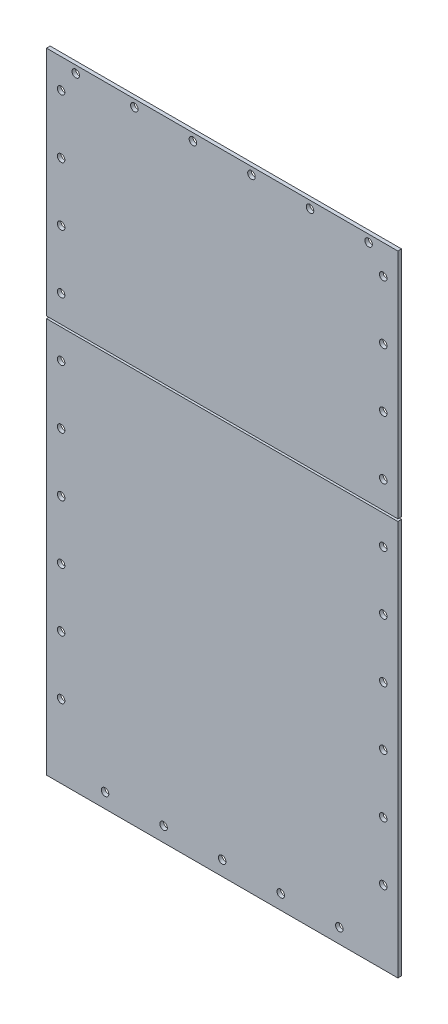
from build123d import *

# Parameters (mm, degrees)
SKETCH1_W             = 152.4
SKETCH1_H             = 100.6
SKETCH1_R             = 1.63195
BOSS_EXTRUDE1_DEPTH   = 1.5875
SKETCH1_H_2           = 171.45
BOSS_EXTRUDE1_2_DEPTH = 1.5875


with BuildPart() as part:
    # Sketch1 → Boss-Extrude1 (new body)
    with BuildSketch(Plane.XY):
        with Locations((76.2, -50.3)):
            Rectangle(SKETCH1_W, SKETCH1_H)
        with Locations((6.35, -88.9)):
            Circle(SKETCH1_R, mode=Mode.SUBTRACT)
        with Locations((6.35, -63.5)):
            Circle(SKETCH1_R, mode=Mode.SUBTRACT)
        with Locations((6.35, -38.1)):
            Circle(SKETCH1_R, mode=Mode.SUBTRACT)
        with Locations((6.35, -12.7)):
            Circle(SKETCH1_R, mode=Mode.SUBTRACT)
        with Locations((12.7, -3.175)):
            Circle(SKETCH1_R, mode=Mode.SUBTRACT)
        with Locations((38.1, -3.175)):
            Circle(SKETCH1_R, mode=Mode.SUBTRACT)
        with Locations((63.5, -3.175)):
            Circle(SKETCH1_R, mode=Mode.SUBTRACT)
        with Locations((146.05, -88.9)):
            Circle(SKETCH1_R, mode=Mode.SUBTRACT)
        with Locations((88.9, -3.175)):
            Circle(SKETCH1_R, mode=Mode.SUBTRACT)
        with Locations((146.05, -63.5)):
            Circle(SKETCH1_R, mode=Mode.SUBTRACT)
        with Locations((146.05, -38.1)):
            Circle(SKETCH1_R, mode=Mode.SUBTRACT)
        with Locations((114.3, -3.175)):
            Circle(SKETCH1_R, mode=Mode.SUBTRACT)
        with Locations((139.7, -3.175)):
            Circle(SKETCH1_R, mode=Mode.SUBTRACT)
        with Locations((146.05, -12.7)):
            Circle(SKETCH1_R, mode=Mode.SUBTRACT)
    extrude(amount=BOSS_EXTRUDE1_DEPTH)


with BuildPart() as body_2:
    # Sketch1 → Boss-Extrude1 2 (new body)
    with BuildSketch(Plane.XY):
        with Locations((76.2, -187.325)):
            Rectangle(SKETCH1_W, SKETCH1_H_2)
        with Locations((6.35, -241.3)):
            Circle(SKETCH1_R, mode=Mode.SUBTRACT)
        with Locations((25.4, -266.7)):
            Circle(SKETCH1_R, mode=Mode.SUBTRACT)
        with Locations((6.35, -215.9)):
            Circle(SKETCH1_R, mode=Mode.SUBTRACT)
        with Locations((50.8, -266.7)):
            Circle(SKETCH1_R, mode=Mode.SUBTRACT)
        with Locations((76.2, -266.7)):
            Circle(SKETCH1_R, mode=Mode.SUBTRACT)
        with Locations((6.35, -190.5)):
            Circle(SKETCH1_R, mode=Mode.SUBTRACT)
        with Locations((6.35, -165.1)):
            Circle(SKETCH1_R, mode=Mode.SUBTRACT)
        with Locations((6.35, -139.7)):
            Circle(SKETCH1_R, mode=Mode.SUBTRACT)
        with Locations((101.6, -266.7)):
            Circle(SKETCH1_R, mode=Mode.SUBTRACT)
        with Locations((127, -266.7)):
            Circle(SKETCH1_R, mode=Mode.SUBTRACT)
        with Locations((146.05, -241.3)):
            Circle(SKETCH1_R, mode=Mode.SUBTRACT)
        with Locations((146.05, -215.9)):
            Circle(SKETCH1_R, mode=Mode.SUBTRACT)
        with Locations((146.05, -190.5)):
            Circle(SKETCH1_R, mode=Mode.SUBTRACT)
        with Locations((146.05, -165.1)):
            Circle(SKETCH1_R, mode=Mode.SUBTRACT)
        with Locations((146.05, -139.7)):
            Circle(SKETCH1_R, mode=Mode.SUBTRACT)
        with Locations((6.35, -114.3)):
            Circle(SKETCH1_R, mode=Mode.SUBTRACT)
        with Locations((146.05, -114.3)):
            Circle(SKETCH1_R, mode=Mode.SUBTRACT)
    extrude(amount=BOSS_EXTRUDE1_2_DEPTH)


solid = Compound([part.part, body_2.part])
